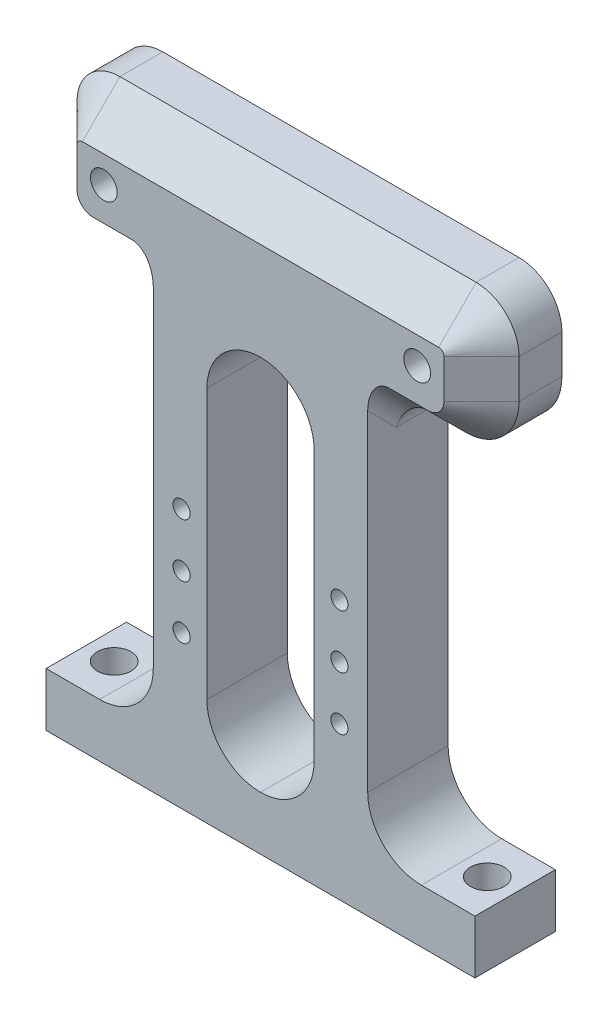
from build123d import *

# Parameters (mm, degrees)
SKETCH1_R                 = 1.5875
EXTRUDE1_DEPTH            = 9.525
SKETCH2_W                 = 12.7
SKETCH2_H                 = 44.635078528
CUT_EXTRUDE1_DEPTH        = 73.561511865
FILLET1_R                 = 6.35
CHAMFER1_SIZE             = 4.445
FILLET2_R                 = 6.35
FILLET3_R                 = 6.35
SKETCH3_R                 = 2.000000064
CUT_EXTRUDE2_DEPTH        = 67.742756192
SKETCH4_R                 = 1.016
EXTRUDE2_DEPTH            = 73.561511865
LPATTERN1_COUNT           = 3
LPATTERN1_PITCH           = 6.35
LPATTERN1_COPY_1_SKETCH_R = 1.016
LPATTERN1_COPY_1_DEPTH    = 73.561511865
LPATTERN1_COPY_2_SKETCH_R = 1.016
LPATTERN1_COPY_2_DEPTH    = 73.561511865
FILLET5_R                 = 2.54


with BuildPart() as part:
    # Sketch1 → Extrude1 (new body)
    with BuildSketch(Plane.XY):
        with BuildLine():
            Line((26.18105, 50.985078528), (26.18105, 61.92))
            ThreePointArc((26.18105, 61.92), (24.693152448, 65.512102448), (21.10105, 67))
            Line((21.10105, 67), (-21.10105, 67))
            ThreePointArc((-21.10105, 67), (-24.693152448, 65.512102448), (-26.18105, 61.92))
            Line((-26.18105, 61.92), (-26.18105, 50.985078528))
            Line((-26.18105, 50.985078528), (-12.7, 50.985078528))
            Line((-12.7, 50.985078528), (-12.7, 6.35))
            Line((-12.7, 6.35), (-25.4, 6.35))
            Line((-25.4, 6.35), (-25.4, 0))
            Line((-25.4, 0), (25.4, 0))
            Line((25.4, 0), (25.4, 6.35))
            Line((25.4, 6.35), (12.7, 6.35))
            Line((12.7, 6.35), (12.7, 50.985078528))
            Line((12.7, 50.985078528), (26.18105, 50.985078528))
        make_face()
        with Locations((-18.56105, 59.38)):
            Circle(SKETCH1_R, mode=Mode.SUBTRACT)
        with Locations((18.56105, 59.38)):
            Circle(SKETCH1_R, mode=Mode.SUBTRACT)
    extrude(amount=-EXTRUDE1_DEPTH)

    # Sketch2 → Cut-Extrude1 (cut, through all)
    with BuildSketch(Plane(origin=(0, 0, -9.525), x_dir=(-1, 0, 0), z_dir=(0, 0, -1))):
        with Locations((0, 28.667539264)):
            Rectangle(SKETCH2_W, SKETCH2_H)
    extrude(amount=-CUT_EXTRUDE1_DEPTH, mode=Mode.SUBTRACT)

    # Fillet1
    fillet1_edges = [part.edges().sort_by_distance(p)[0] for p in [
        (-26.18105, 50.985078528, -4.7625),
        (26.18105, 50.985078528, -4.7625),
    ]]
    fillet(fillet1_edges, radius=FILLET1_R)

    # Chamfer1
    chamfer1_edges = [part.edges().sort_by_distance(p)[0] for p in [
        (-16.265525, 50.985078528, 0),
        (-26.18105, 59.627539264, 0),
        (16.265525, 50.985078528, 0),
        (0, 67, 0),
        (26.18105, 59.627539264, 0),
    ]]
    chamfer(chamfer1_edges, length=CHAMFER1_SIZE)

    # Fillet2
    fillet2_edges = [part.edges().sort_by_distance(p)[0] for p in [
        (6.35, 50.985078528, -4.7625),
        (-6.35, 50.985078528, -4.7625),
        (6.35, 6.35, -4.7625),
        (-6.35, 6.35, -4.7625),
    ]]
    fillet(fillet2_edges, radius=FILLET2_R - 0.0001)  # a hair under: the kernel refuses the full size

    # Fillet3
    fillet3_edges = [part.edges().sort_by_distance(p)[0] for p in [
        (-12.7, 6.35, -4.7625),
        (12.7, 6.35, -4.7625),
    ]]
    fillet(fillet3_edges, radius=FILLET3_R)

    # Sketch3 → Cut-Extrude2 (cut, through all)
    with BuildSketch(Plane(origin=(0, 6.35, 0), x_dir=(1, 0, 0), z_dir=(0, 1, 0))):
        with Locations(Location((-22.098, 4.7625, 0), (0, 0, 270))):
            Circle(SKETCH3_R)
    cut_extrude2 = extrude(amount=-CUT_EXTRUDE2_DEPTH, mode=Mode.SUBTRACT)

    # Mirror2: Cut-Extrude2 across plane
    add(cut_extrude2.mirror(Plane(origin=(0, 0, 0), x_dir=(0, 0, 1), z_dir=(1, 0, 0))), mode=Mode.SUBTRACT)

    # Sketch4 → Extrude2 (cut, through all)
    with BuildSketch(Plane.XY):
        with Locations((9.345089473, 30.742631811)):
            Circle(SKETCH4_R)
    extrude2 = extrude(amount=-EXTRUDE2_DEPTH, mode=Mode.SUBTRACT)

    # Mirror3: Extrude2 across plane
    add(extrude2.mirror(Plane(origin=(0, 0, 0), x_dir=(0, 0, 1), z_dir=(1, 0, 0))), mode=Mode.SUBTRACT)

    # LPattern1: Extrude2 ×3
    with Locations(*[(0, -i * LPATTERN1_PITCH, 0) for i in range(1, LPATTERN1_COUNT)]):
        add(extrude2, mode=Mode.SUBTRACT)

    # LPattern1 copy 1 sketch → LPattern1 copy 1 (cut, through all)
    with BuildSketch(Plane(origin=(0, -6.35, 0), x_dir=(-1, 0, 0), z_dir=(0, 0, 1))):
        with Locations((9.345089473, -30.742631811)):
            Circle(LPATTERN1_COPY_1_SKETCH_R)
    extrude(amount=-LPATTERN1_COPY_1_DEPTH, mode=Mode.SUBTRACT)

    # LPattern1 copy 2 sketch → LPattern1 copy 2 (cut, through all)
    with BuildSketch(Plane(origin=(0, -12.7, 0), x_dir=(-1, 0, 0), z_dir=(0, 0, 1))):
        with Locations((9.345089473, -30.742631811)):
            Circle(LPATTERN1_COPY_2_SKETCH_R)
    extrude(amount=-LPATTERN1_COPY_2_DEPTH, mode=Mode.SUBTRACT)

    # Fillet5
    fillet5_edges = [part.edges().sort_by_distance(p)[0] for p in [
        (-12.7, 50.985078528, -6.985),
        (12.7, 50.985078528, -6.985),
        (-12.7, 53.207578528, -2.2225),
        (12.7, 53.207578528, -2.2225),
    ]]
    fillet(fillet5_edges, radius=FILLET5_R)


solid = part.part
